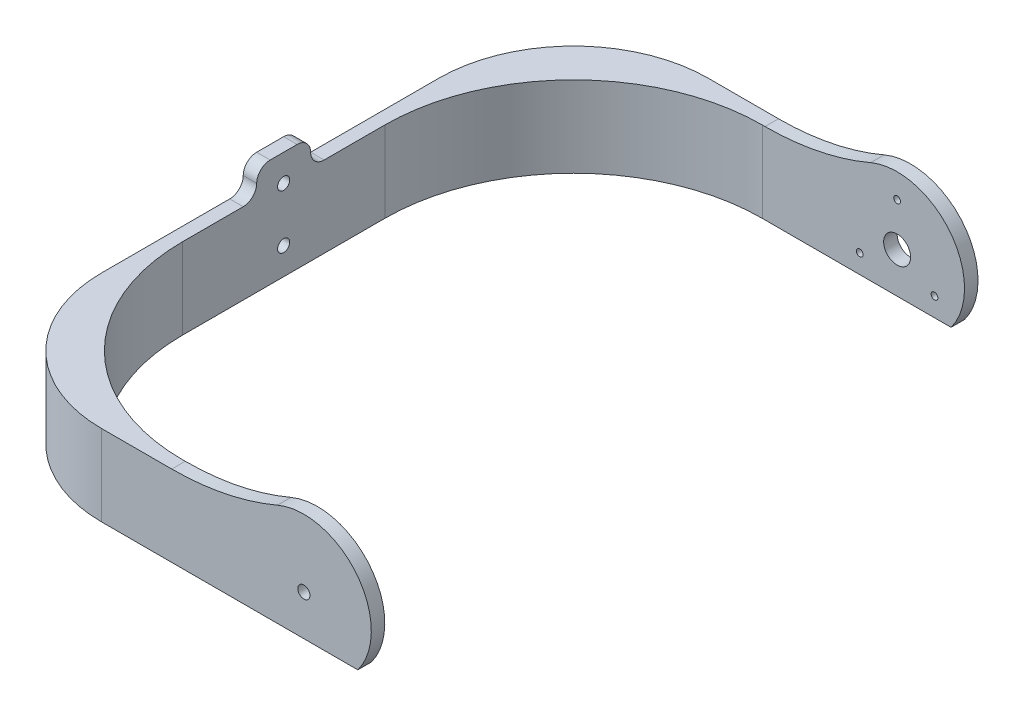
from build123d import *

# Parameters (mm, degrees)
SKETCH1_W           = 125
SKETCH1_H           = 30
BOSS_EXTRUDE1_DEPTH = 112.5
BOSS_EXTRUDE2_DEPTH = 112.5
CUT_EXTRUDE2_START  = 5
SKETCH4_W           = 215
SKETCH4_H           = 59.703545047
CUT_EXTRUDE2_DEPTH  = 160
SKETCH5_R           = 1.25
SKETCH5_R_2         = 5
CUT_EXTRUDE3_DEPTH  = 10
FILLET1_R           = 100
FILLET2_R           = 70
FILLET3_R           = 50
SKETCH7_W           = 20
SKETCH7_H           = 10
BOSS_EXTRUDE3_DEPTH = 5
SKETCH6_R           = 2.25
CUT_EXTRUDE4_DEPTH  = 10
FILLET4_R           = 5
FILLET5_R           = 5
SKETCH8_R           = 2.25
CUT_EXTRUDE5_DEPTH  = 5


with BuildPart() as part:
    # Sketch1 → Boss-Extrude1 (new, symmetric)
    with BuildSketch(Plane.XY):
        with Locations((62.5, 15)):
            Rectangle(SKETCH1_W, SKETCH1_H)
    extrude(amount=BOSS_EXTRUDE1_DEPTH, both=True)

    # Sketch2 → Boss-Extrude2 (add, symmetric)
    with BuildSketch(Plane.XY):
        with BuildLine():
            Line((105, 0), (145, 0))
            ThreePointArc((145, 0), (125, 40), (105, 0))
        make_face()
    extrude(amount=BOSS_EXTRUDE2_DEPTH, both=True)

    # Sketch4 → Cut-Extrude2 (cut)
    with BuildSketch(Plane(origin=(0, 0, 0), x_dir=(0, 0, -1), z_dir=(1, 0, 0)).offset(CUT_EXTRUDE2_START)):
        with Locations((0, 25.910589708)):
            Rectangle(SKETCH4_W, SKETCH4_H)
    extrude(amount=CUT_EXTRUDE2_DEPTH, mode=Mode.SUBTRACT)

    # Sketch5 → Cut-Extrude3 (cut)
    with BuildSketch(Plane(origin=(0, 0, -112.5), x_dir=(-1, 0, 0), z_dir=(0, 0, -1))):
        with Locations((-138.856406461, 7)):
            Circle(SKETCH5_R)
        with Locations((-125, 31)):
            Circle(SKETCH5_R)
        with Locations((-111.143593539, 7)):
            Circle(SKETCH5_R)
        with Locations((-125.004149617, 15)):
            Circle(SKETCH5_R_2)
    extrude(amount=-CUT_EXTRUDE3_DEPTH, mode=Mode.SUBTRACT)

    # Fillet1
    fillet1_edges = [part.edges().sort_by_distance(p)[0] for p in [
        (105, 30, -110),
        (105, 30, 110),
    ]]
    fillet(fillet1_edges, radius=FILLET1_R)

    # Fillet2
    fillet2_edges = [part.edges().sort_by_distance(p)[0] for p in [
        (5, 15, 107.5),
        (5, 15, -107.5),
    ]]
    fillet(fillet2_edges, radius=FILLET2_R)

    # Fillet3
    fillet3_edges = [part.edges().sort_by_distance(p)[0] for p in [
        (0, 15, 112.5),
        (0, 15, -112.5),
    ]]
    fillet(fillet3_edges, radius=FILLET3_R)

    # Sketch7 → Boss-Extrude3 (add)
    with BuildSketch(Plane.ZY):
        with Locations((0, 35)):
            Rectangle(SKETCH7_W, SKETCH7_H)
    extrude(amount=-BOSS_EXTRUDE3_DEPTH)

    # Sketch6 → Cut-Extrude4 (cut)
    with BuildSketch(Plane.ZY):
        with Locations((0, 10)):
            Circle(SKETCH6_R)
        with Locations((0, 30)):
            Circle(SKETCH6_R)
    extrude(amount=-CUT_EXTRUDE4_DEPTH, mode=Mode.SUBTRACT)

    # Fillet4
    fillet4_edges = [part.edges().sort_by_distance(p)[0] for p in [
        (2.5, 30, 10),
        (2.5, 30, -10),
    ]]
    fillet(fillet4_edges, radius=FILLET4_R)

    # Fillet5
    fillet5_edges = [part.edges().sort_by_distance(p)[0] for p in [
        (2.5, 40, 10),
        (2.5, 40, -10),
    ]]
    fillet(fillet5_edges, radius=FILLET5_R - 0.0001)  # a hair under: the kernel refuses the full size

    # Sketch8 → Cut-Extrude5 (cut)
    with BuildSketch(Plane(origin=(0, 0, 107.5), x_dir=(-1, 0, 0), z_dir=(0, 0, -1))):
        with Locations(Location((-125, 15, 0), (0, 0, 90))):
            Circle(SKETCH8_R)
    extrude(amount=-CUT_EXTRUDE5_DEPTH, mode=Mode.SUBTRACT)


solid = part.part
